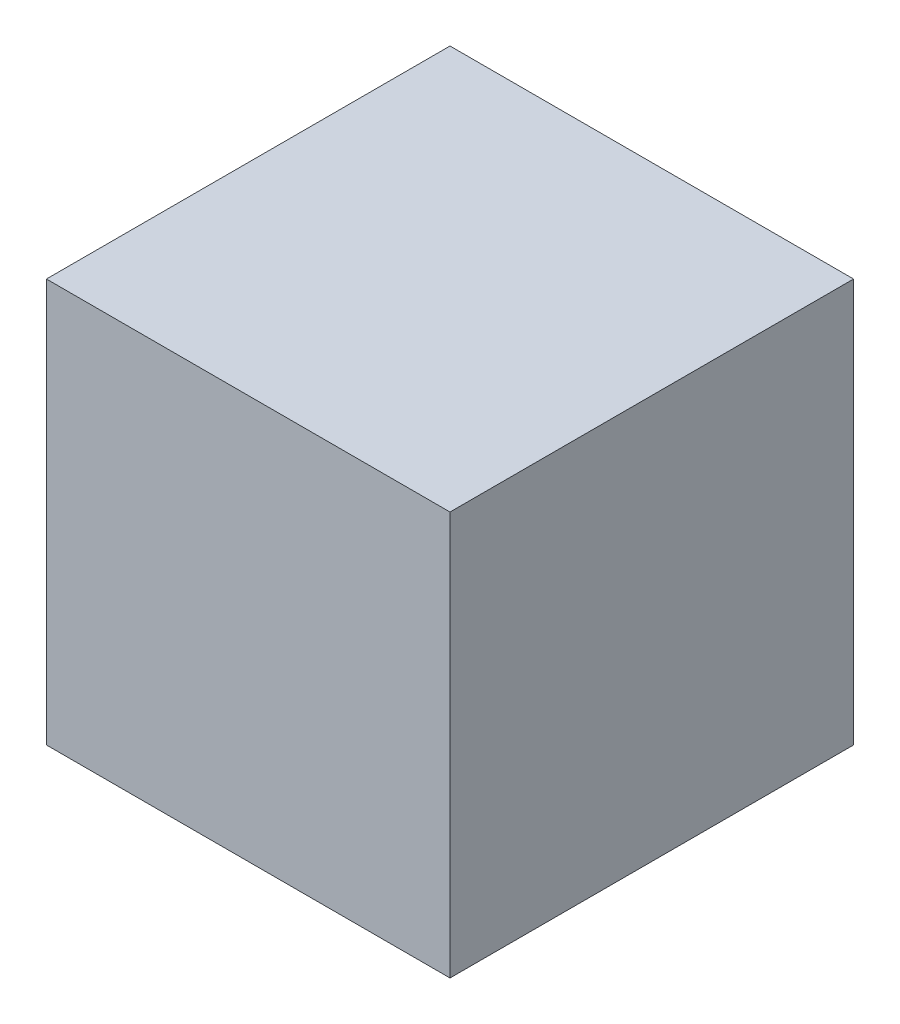
from build123d import *

# Parameters (mm, degrees)
EXTRUDE_1_DEPTH      = 32
EXTRUDE_1_DEPTH_BACK = 32


with BuildPart() as part:
    # 草图2 → 凸台-拉伸1 (new, two sides: drawn at the far end of the back side and taken through both)
    with BuildSketch(Plane.XY.offset(-EXTRUDE_1_DEPTH_BACK)):
        Polygon((0, 0), (32, 0), (32, 64), (-32, 64), (-32, 0), align=None)
    extrude(amount=EXTRUDE_1_DEPTH + EXTRUDE_1_DEPTH_BACK)


solid = part.part
